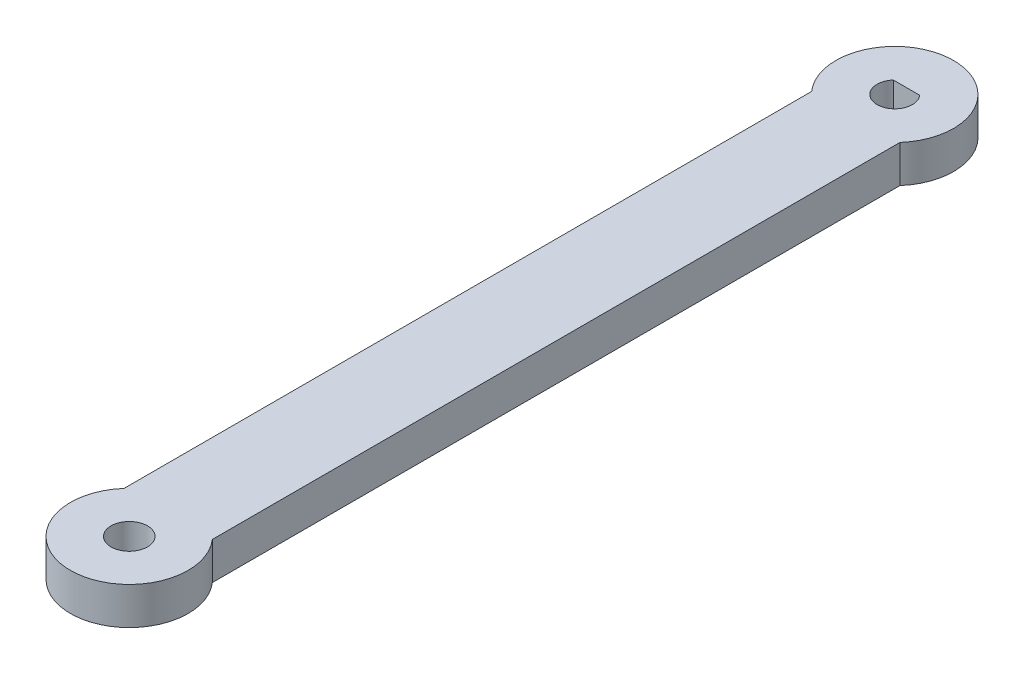
from build123d import *

# Parameters (mm, degrees)
SKETCH1_R           = 1.55
BOSS_EXTRUDE1_DEPTH = 3.175


with BuildPart() as part:
    # Sketch1 → Boss-Extrude1 (new body)
    with BuildSketch(Plane(origin=(0, 0, 0), x_dir=(1, 0, 0), z_dir=(0, 1, 0))):
        with BuildLine():
            Line((-3.75, -61.692810861), (-3.75, -3.307189139))
            ThreePointArc((-3.75, -3.307189139), (0, 5), (3.75, -3.307189139))
            Line((3.75, -3.307189139), (3.75, -61.692810861))
            ThreePointArc((3.75, -61.692810861), (0, -70), (-3.75, -61.692810861))
        make_face()
        with Locations((0, -65)):
            Circle(SKETCH1_R, mode=Mode.SUBTRACT)
        with BuildLine():
            Line((-1.118033989, 1), (1.118033989, 1))
            ThreePointArc((1.118033989, 1), (0, -1.5), (-1.118033989, 1))
        make_face(mode=Mode.SUBTRACT)
    extrude(amount=BOSS_EXTRUDE1_DEPTH)


solid = part.part
